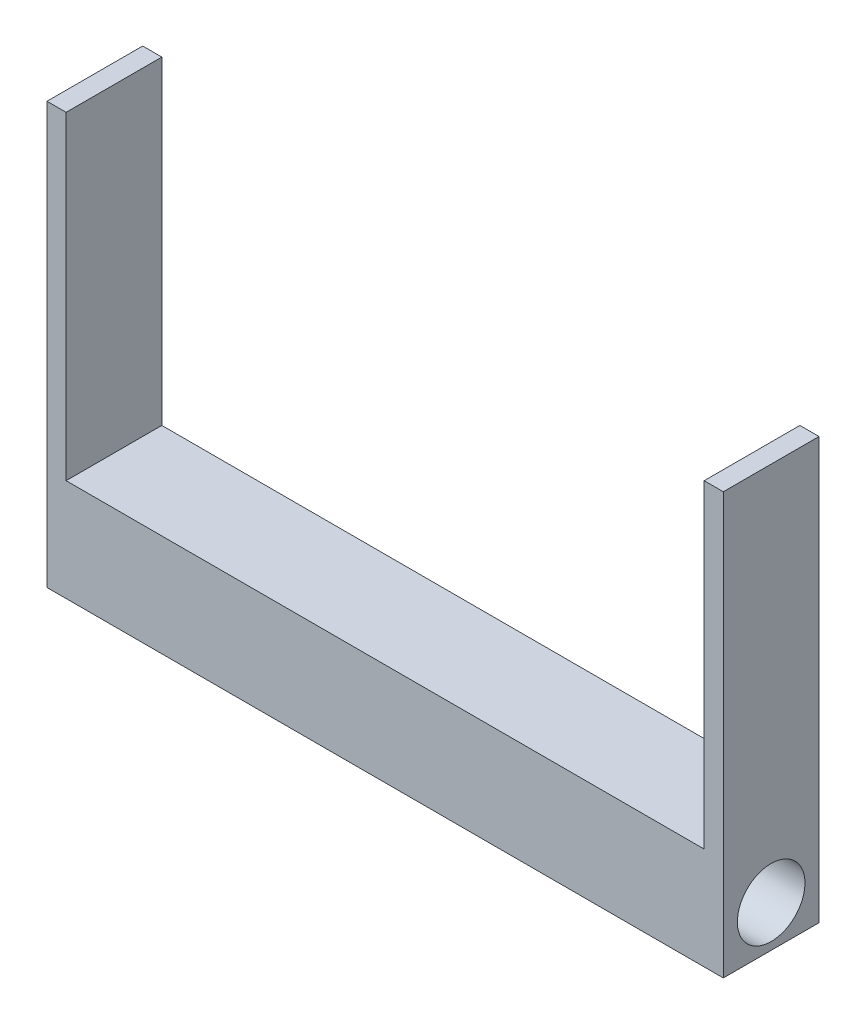
from build123d import *

# Parameters (mm, degrees)
EXTRUDE_THIN1_DEPTH = 7.5
SKETCH4_W           = 106
SKETCH4_H           = 15
BOSS_EXTRUDE1_DEPTH = 13
SKETCH5_R           = 5.3
CUT_EXTRUDE1_DEPTH  = 126.09296543


with BuildPart() as part:
    # Sketch1 → Extrude-Thin1 (new, symmetric)
    with BuildSketch(Plane.XY):
        Polygon((-50, 0), (-50, -50), (50, -50), (50, 0), (53, 0), (53, -53), (-53, -53), (-53, 0), align=None)
    extrude(amount=EXTRUDE_THIN1_DEPTH, both=True)

    # Sketch4 → Boss-Extrude1 (add)
    with BuildSketch(Plane.XZ.offset(53)):
        Rectangle(SKETCH4_W, SKETCH4_H)
    extrude(amount=BOSS_EXTRUDE1_DEPTH)

    # Sketch5 → Cut-Extrude1 (cut, through all)
    with BuildSketch(Plane(origin=(53, 0, 0), x_dir=(0, 0, -1), z_dir=(1, 0, 0))):
        with Locations((0, -59.5)):
            Circle(SKETCH5_R)
    extrude(amount=-CUT_EXTRUDE1_DEPTH, mode=Mode.SUBTRACT)


solid = part.part
